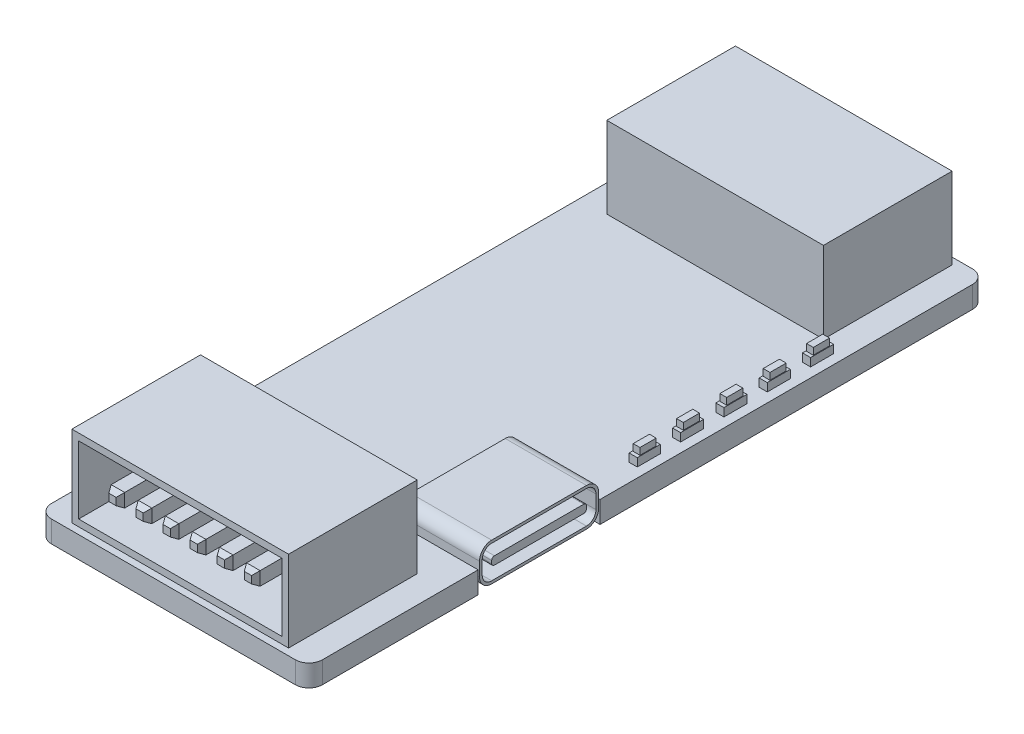
from build123d import *
from OCP.BRepFilletAPI import BRepFilletAPI_MakeChamfer

# Parameters (mm, degrees)
EXTRUDE_1_DEPTH        = 1.6
SKETCH_2_W             = 16
SKETCH_2_H             = 10
EXTRUDE_2_DEPTH        = 6
SKETCH_3_W             = 9
SKETCH_3_H             = 3
EXTRUDE_3_DEPTH        = 6
CUT_EXTRUDE_1_DEPTH    = 6
CUT_EXTRUDE_2_DEPTH    = 6
CUT_EXTRUDE_4_DEPTH    = 5
SKETCH_7_W             = 16
SKETCH_7_H             = 6
CUT_EXTRUDE_5_DEPTH    = 0.5
SKETCH_8_W             = 16
SKETCH_8_H             = 6
CUT_EXTRUDE_6_DEPTH    = 0.5
SKETCH_9_W             = 0.6
SKETCH_9_H             = 1.7
EXTRUDE_4_DEPTH        = 0.6
SKETCH_10_W            = 0.5
SKETCH_10_H            = 1.2
EXTRUDE_6_DEPTH        = 0.5
PATTERN_LINEAR_1_COUNT = 5
PATTERN_LINEAR_1_PITCH = 3.2
SKETCH_11_W            = 5.2
SKETCH_11_H            = 5.2
EXTRUDE_7_DEPTH        = 1.3
SKETCH_12_R            = 1
EXTRUDE_8_DEPTH        = 0.2
CHAMFER_1_SIZE         = 1
CUT_EXTRUDE_7_DEPTH    = 0.5
FILLET_1_R             = 0.5
FILLET_2_R             = 0.25
FILLET_3_R             = 0.1
SKETCH_14_W            = 15
SKETCH_14_H            = 5
SKETCH_14_W_2          = 1
SKETCH_14_H_2          = 1
CUT_EXTRUDE_8_DEPTH    = 8
CHAMFER_3_SIZE         = 0.4
CHAMFER_3_SIZE2        = 0.230940108
CHAMFER_4_SIZE         = 0.4
CHAMFER_4_SIZE2        = 0.230940108
CHAMFER_5_SIZE         = 0.4
CHAMFER_5_SIZE2        = 0.230940108


with BuildPart() as part:
    # 草图1 → 凸台-拉伸1 (new body)
    with BuildSketch(Plane(origin=(0, 0, 0), x_dir=(1, 0, 0), z_dir=(0, 1, 0))):
        with BuildLine():
            Line((-9, 25), (9, 25))
            ThreePointArc((9, 25), (9.707106781, 24.707106781), (10, 24))
            Line((10, 24), (10, -3.5))
            Line((10, -3.5), (4, -3.5))
            Line((4, -3.5), (4, -12.5))
            Line((4, -12.5), (10, -12.5))
            Line((10, -12.5), (10, -24))
            ThreePointArc((10, -24), (9.707106781, -24.707106781), (9, -25))
            Line((9, -25), (-9, -25))
            ThreePointArc((-9, -25), (-9.707106781, -24.707106781), (-10, -24))
            Line((-10, -24), (-10, 24))
            ThreePointArc((-10, 24), (-9.707106781, 24.707106781), (-9, 25))
        make_face()
    extrude(amount=EXTRUDE_1_DEPTH)

    # 草图2 → 凸台-拉伸2 (add)
    with BuildSketch(Plane(origin=(0, 1.6, 0), x_dir=(1, 0, 0), z_dir=(0, 1, 0))):
        with Locations((0, 20)):
            Rectangle(SKETCH_2_W, SKETCH_2_H)
        with Locations((0, -20)):
            Rectangle(SKETCH_2_W, SKETCH_2_H)
    extrude(amount=EXTRUDE_2_DEPTH)

    # 草图3 → 凸台-拉伸3 (add)
    with BuildSketch(Plane(origin=(4, 0, 0), x_dir=(0, 0, -1), z_dir=(1, 0, 0))):
        with Locations((-8, 1.6)):
            Rectangle(SKETCH_3_W, SKETCH_3_H)
    extrude(amount=EXTRUDE_3_DEPTH)

    # 草图4 → 切除-拉伸1 (cut)
    with BuildSketch(Plane(origin=(10, 0, 0), x_dir=(0, 0, -1), z_dir=(1, 0, 0))):
        with BuildLine():
            Line((-3.5, 1.1), (-3.5, 0.1))
            Line((-3.5, 0.1), (-4.5, 0.1))
            ThreePointArc((-4.5, 0.1), (-3.792893219, 0.392893219), (-3.5, 1.1))
        make_face()
        with BuildLine():
            Line((-12.5, 1.1), (-12.5, 0.1))
            Line((-12.5, 0.1), (-11.5, 0.1))
            ThreePointArc((-11.5, 0.1), (-12.207106781, 0.392893219), (-12.5, 1.1))
        make_face()
        with BuildLine():
            Line((-12.5, 3.1), (-12.5, 2.1))
            ThreePointArc((-12.5, 2.1), (-12.207106781, 2.807106781), (-11.5, 3.1))
            Line((-11.5, 3.1), (-12.5, 3.1))
        make_face()
        with BuildLine():
            Line((-3.5, 3.1), (-4.5, 3.1))
            ThreePointArc((-4.5, 3.1), (-3.792893219, 2.807106781), (-3.5, 2.1))
            Line((-3.5, 2.1), (-3.5, 3.1))
        make_face()
    extrude(amount=-CUT_EXTRUDE_1_DEPTH, mode=Mode.SUBTRACT)

    # 草图5 → 切除-拉伸2 (cut)
    with BuildSketch(Plane(origin=(10, 0, 0), x_dir=(0, 0, -1), z_dir=(1, 0, 0))):
        with BuildLine():
            Line((-11.5, 0.1), (-4.5, 0.1))
            ThreePointArc((-4.5, 0.1), (-3.792893219, 0.392893219), (-3.5, 1.1))
            Line((-3.5, 1.1), (-3.5, 2.1))
            ThreePointArc((-3.5, 2.1), (-3.792893219, 2.807106781), (-4.5, 3.1))
            Line((-4.5, 3.1), (-11.5, 3.1))
            ThreePointArc((-11.5, 3.1), (-12.207106781, 2.807106781), (-12.5, 2.1))
            Line((-12.5, 2.1), (-12.5, 1.1))
            ThreePointArc((-12.5, 1.1), (-12.207106781, 0.392893219), (-11.5, 0.1))
        make_face()
        with BuildLine():
            Line((-11.5, 0.2), (-4.5, 0.2))
            ThreePointArc((-4.5, 0.2), (-3.863603897, 0.463603897), (-3.6, 1.1))
            Line((-3.6, 1.1), (-3.6, 2.1))
            ThreePointArc((-3.6, 2.1), (-3.863603897, 2.736396103), (-4.5, 3))
            Line((-4.5, 3), (-11.5, 3))
            ThreePointArc((-11.5, 3), (-12.136396103, 2.736396103), (-12.4, 2.1))
            Line((-12.4, 2.1), (-12.4, 1.1))
            ThreePointArc((-12.4, 1.1), (-12.136396103, 0.463603897), (-11.5, 0.2))
        make_face(mode=Mode.SUBTRACT)
    extrude(amount=-CUT_EXTRUDE_2_DEPTH, mode=Mode.SUBTRACT)

    # 草图6 → 切除-拉伸4 (cut)
    with BuildSketch(Plane(origin=(10, 0, 0), x_dir=(0, 0, -1), z_dir=(1, 0, 0))):
        with BuildLine():
            Line((-11.5, 0.4), (-4.5, 0.4))
            ThreePointArc((-4.5, 0.4), (-4.005025253, 0.605025253), (-3.8, 1.1))
            Line((-3.8, 1.1), (-3.8, 2.1))
            ThreePointArc((-3.8, 2.1), (-4.005025253, 2.594974747), (-4.5, 2.8))
            Line((-4.5, 2.8), (-11.5, 2.8))
            ThreePointArc((-11.5, 2.8), (-11.994974747, 2.594974747), (-12.2, 2.1))
            Line((-12.2, 2.1), (-12.2, 1.1))
            ThreePointArc((-12.2, 1.1), (-11.994974747, 0.605025253), (-11.5, 0.4))
        make_face()
        with BuildLine():
            Line((-4.7, 1.9), (-11.3, 1.9))
            ThreePointArc((-11.3, 1.9), (-11.441421356, 1.841421356), (-11.5, 1.7))
            Line((-11.5, 1.7), (-11.5, 1.5))
            ThreePointArc((-11.5, 1.5), (-11.441421356, 1.358578644), (-11.3, 1.3))
            Line((-11.3, 1.3), (-4.7, 1.3))
            ThreePointArc((-4.7, 1.3), (-4.558578644, 1.358578644), (-4.5, 1.5))
            Line((-4.5, 1.5), (-4.5, 1.7))
            ThreePointArc((-4.5, 1.7), (-4.558578644, 1.841421356), (-4.7, 1.9))
        make_face(mode=Mode.SUBTRACT)
    extrude(amount=-CUT_EXTRUDE_4_DEPTH, mode=Mode.SUBTRACT)

    # 草图7 → 切除-拉伸5 (cut)
    with BuildSketch(Plane(origin=(0, 0, -25), x_dir=(-1, 0, 0), z_dir=(0, 0, -1))):
        with Locations((0, 4.6)):
            Rectangle(SKETCH_7_W, SKETCH_7_H)
    extrude(amount=-CUT_EXTRUDE_5_DEPTH, mode=Mode.SUBTRACT)

    # 草图8 → 切除-拉伸6 (cut)
    with BuildSketch(Plane.XY.offset(25)):
        with Locations((0, 4.6)):
            Rectangle(SKETCH_8_W, SKETCH_8_H)
    extrude(amount=-CUT_EXTRUDE_6_DEPTH, mode=Mode.SUBTRACT)

    # 草图9 → 凸台-拉伸4 (add)
    with BuildSketch(Plane(origin=(0, 1.6, 0), x_dir=(1, 0, 0), z_dir=(0, 1, 0))):
        with Locations((9, 13.6)):
            Rectangle(SKETCH_9_W, SKETCH_9_H)
    extrude_4 = extrude(amount=EXTRUDE_4_DEPTH)

    # 草图10 → 凸台-拉伸6 (add)
    with BuildSketch(Plane(origin=(0, 2.2, 0), x_dir=(1, 0, 0), z_dir=(0, 1, 0))):
        with Locations((9, 13.6)):
            Rectangle(SKETCH_10_W, SKETCH_10_H)
    extrude_6 = extrude(amount=EXTRUDE_6_DEPTH)

    # 阵列(线性)1: 凸台-拉伸4, 凸台-拉伸6 ×5
    with Locations(*[(0, 0, i * PATTERN_LINEAR_1_PITCH) for i in range(1, PATTERN_LINEAR_1_COUNT)]):
        add(extrude_4)
        add(extrude_6)

    # 草图11 → 凸台-拉伸7 (add)
    with BuildSketch(Plane(origin=(0, 0, 0), x_dir=(-1, 0, 0), z_dir=(0, -1, 0))):
        with Locations((0, 15)):
            Rectangle(SKETCH_11_W, SKETCH_11_H)
    extrude(amount=EXTRUDE_7_DEPTH)

    # 草图12 → 凸台-拉伸8 (add)
    with BuildSketch(Plane(origin=(0, -1.3, 0), x_dir=(-1, 0, 0), z_dir=(0, -1, 0))):
        with Locations(Location((0, 15, 0), (0, 0, 90))):
            Circle(SKETCH_12_R)
    extrude(amount=EXTRUDE_8_DEPTH)

    # 倒角1
    chamfer_1_edges = [part.edges().sort_by_distance(p)[0] for p in [
        (-2.6, -0.65, -12.4),
        (-2.6, -0.65, -17.6),
        (2.6, -0.65, -17.6),
        (2.6, -0.65, -12.4),
    ]]
    chamfer(chamfer_1_edges, length=CHAMFER_1_SIZE)

    # 草图13 → 切除-拉伸7 (cut)
    with BuildSketch(Plane(origin=(0, -1.3, 0), x_dir=(-1, 0, 0), z_dir=(0, -1, 0))):
        Polygon((1.6, 17.6), (-1.6, 17.6), (-2.6, 16.6), (-2.6, 13.4), (-1.6, 12.4), (1.6, 12.4), (2.6, 13.4), (2.6, 16.6), align=None)
        Polygon((1.185786438, 16.6), (-1.185786438, 16.6), (-1.6, 16.185786438), (-1.6, 13.814213562), (-1.185786438, 13.4), (1.185786438, 13.4), (1.6, 13.814213562), (1.6, 16.185786438), align=None, mode=Mode.SUBTRACT)
    extrude(amount=-CUT_EXTRUDE_7_DEPTH, mode=Mode.SUBTRACT)

    # 圆角1
    fillet_1_edges = [part.edges().sort_by_distance(p)[0] for p in [
        (2.6, -0.4, -13.4),
        (1.6, -0.4, -17.6),
        (-2.6, -0.4, -16.6),
        (-1.6, -0.4, -12.4),
        (1.6, -0.4, -12.4),
        (-2.6, -0.4, -13.4),
        (-1.6, -0.4, -17.6),
        (2.6, -0.4, -16.6),
        (-1.6, -1.05, -16.185786438),
        (-1.6, -1.05, -13.814213562),
        (-1.185786438, -1.05, -13.4),
        (1.185786438, -1.05, -13.4),
        (1.6, -1.05, -13.814213562),
        (1.6, -1.05, -16.185786438),
        (1.185786438, -1.05, -16.6),
        (-1.185786438, -1.05, -16.6),
    ]]
    fillet(fillet_1_edges, radius=FILLET_1_R)

    # 圆角2
    fillet_2_edges = [part.edges().sort_by_distance(p)[0] for p in [
        (2.561939766, -0.8, -16.584234935),
        (2.1, -0.8, -17.1),
        (1.584234935, -0.8, -17.561939766),
        (0, -0.8, -17.6),
        (-1.584234935, -0.8, -17.561939766),
        (-2.1, -0.8, -17.1),
        (-2.561939766, -0.8, -16.584234935),
        (-2.6, -0.8, -15),
        (-2.561939766, -0.8, -13.415765065),
        (-2.1, -0.8, -12.9),
        (-1.584234935, -0.8, -12.438060234),
        (0, -0.8, -12.4),
        (1.584234935, -0.8, -12.438060234),
        (2.1, -0.8, -12.9),
        (2.561939766, -0.8, -13.415765065),
        (1.561939766, -1.3, -16.170021373),
        (1.392893219, -1.3, -16.392893219),
        (1.170021373, -1.3, -16.561939766),
        (0, -1.3, -16.6),
        (-1.170021373, -1.3, -16.561939766),
        (-1.392893219, -1.3, -16.392893219),
        (-1.561939766, -1.3, -16.170021373),
        (-1.6, -1.3, -15),
        (-1.561939766, -1.3, -13.829978627),
        (-1.392893219, -1.3, -13.607106781),
        (-1.170021373, -1.3, -13.438060234),
        (0, -1.3, -13.4),
        (1.170021373, -1.3, -13.438060234),
        (1.392893219, -1.3, -13.607106781),
        (1.561939766, -1.3, -13.829978627),
        (1.561939766, -0.8, -16.170021373),
        (1.392893219, -0.8, -16.392893219),
        (1.170021373, -0.8, -16.561939766),
        (0, -0.8, -16.6),
        (-1.170021373, -0.8, -16.561939766),
        (-1.392893219, -0.8, -16.392893219),
        (-1.561939766, -0.8, -16.170021373),
        (-1.6, -0.8, -15),
        (-1.561939766, -0.8, -13.829978627),
        (-1.392893219, -0.8, -13.607106781),
        (-1.170021373, -0.8, -13.438060234),
        (0, -0.8, -13.4),
        (1.170021373, -0.8, -13.438060234),
        (1.392893219, -0.8, -13.607106781),
        (1.561939766, -0.8, -13.829978627),
        (2.6, -0.8, -15),
        (1.6, -1.3, -15),
        (1.6, -0.8, -15),
    ]]
    fillet(fillet_2_edges, radius=FILLET_2_R - 0.0001)  # a hair under: the kernel refuses the full size

    # 圆角3
    fillet_3_edges = [part.edges().sort_by_distance(p)[0] for p in [
        (0, -1.5, -14),
    ]]
    fillet(fillet_3_edges, radius=FILLET_3_R)

    # 草图14 → 切除-拉伸8 (cut)
    with BuildSketch(Plane(origin=(0, 0, -24.5), x_dir=(-1, 0, 0), z_dir=(0, 0, -1))):
        with Locations((0, 4.6)):
            Rectangle(SKETCH_14_W, SKETCH_14_H)
        with Locations((-5, 4.6)):
            Rectangle(SKETCH_14_W_2, SKETCH_14_H_2, mode=Mode.SUBTRACT)
        with Locations((-3, 4.6)):
            Rectangle(SKETCH_14_W_2, SKETCH_14_H_2, mode=Mode.SUBTRACT)
        with Locations((-1, 4.6)):
            Rectangle(SKETCH_14_W_2, SKETCH_14_H_2, mode=Mode.SUBTRACT)
        with Locations((1, 4.6)):
            Rectangle(SKETCH_14_W_2, SKETCH_14_H_2, mode=Mode.SUBTRACT)
        with Locations((3, 4.6)):
            Rectangle(SKETCH_14_W_2, SKETCH_14_H_2, mode=Mode.SUBTRACT)
        with Locations((5, 4.6)):
            Rectangle(SKETCH_14_W_2, SKETCH_14_H_2, mode=Mode.SUBTRACT)
    cut_extrude_8 = extrude(amount=-CUT_EXTRUDE_8_DEPTH, mode=Mode.SUBTRACT)

    # 倒角3: one chamfer whose edges measure the first distance from different faces: ONE call of the kernel's chamfer builder (chamfer() names one face for all edges)
    chamfer_3_edges_1 = [part.edges().sort_by_distance(p)[0] for p in [
        (-4.5, 4.6, -24.5),
    ]]
    chamfer_3_side_1 = [part.faces().sort_by_distance(p)[0] for p in [
        (-4.5, 4.6, -20.5),
    ]]
    chamfer_3_edges_2 = [part.edges().sort_by_distance(p)[0] for p in [
        (-5, 4.1, -24.5),
    ]]
    chamfer_3_side_2 = [part.faces().sort_by_distance(p)[0] for p in [
        (-5, 4.1, -20.5),
    ]]
    chamfer_3_edges_3 = [part.edges().sort_by_distance(p)[0] for p in [
        (-5, 5.1, -24.5),
    ]]
    chamfer_3_side_3 = [part.faces().sort_by_distance(p)[0] for p in [
        (-5, 5.1, -20.5),
    ]]
    chamfer_3_edges_4 = [part.edges().sort_by_distance(p)[0] for p in [
        (-5.5, 4.6, -24.5),
    ]]
    chamfer_3_side_4 = [part.faces().sort_by_distance(p)[0] for p in [
        (-5.5, 4.6, -20.5),
    ]]
    chamfer_3 = BRepFilletAPI_MakeChamfer(part.part.solid().wrapped)
    for e in chamfer_3_edges_1:
        chamfer_3.Add(CHAMFER_3_SIZE, CHAMFER_3_SIZE2, e.wrapped, chamfer_3_side_1[0].wrapped)  # the first distance lies on this face
    for e in chamfer_3_edges_2:
        chamfer_3.Add(CHAMFER_3_SIZE, CHAMFER_3_SIZE2, e.wrapped, chamfer_3_side_2[0].wrapped)  # the first distance lies on this face
    for e in chamfer_3_edges_3:
        chamfer_3.Add(CHAMFER_3_SIZE, CHAMFER_3_SIZE2, e.wrapped, chamfer_3_side_3[0].wrapped)  # the first distance lies on this face
    for e in chamfer_3_edges_4:
        chamfer_3.Add(CHAMFER_3_SIZE, CHAMFER_3_SIZE2, e.wrapped, chamfer_3_side_4[0].wrapped)  # the first distance lies on this face
    add(Compound.cast(chamfer_3.Shape()), mode=Mode.REPLACE)

    # 倒角4: one chamfer whose edges measure the first distance from different faces: ONE call of the kernel's chamfer builder (chamfer() names one face for all edges)
    chamfer_4_edges_1 = [part.edges().sort_by_distance(p)[0] for p in [
        (-3, 4.1, -24.5),
    ]]
    chamfer_4_side_1 = [part.faces().sort_by_distance(p)[0] for p in [
        (-3, 4.1, -20.5),
    ]]
    chamfer_4_edges_2 = [part.edges().sort_by_distance(p)[0] for p in [
        (-1, 4.1, -24.5),
    ]]
    chamfer_4_side_2 = [part.faces().sort_by_distance(p)[0] for p in [
        (-1, 4.1, -20.5),
    ]]
    chamfer_4_edges_3 = [part.edges().sort_by_distance(p)[0] for p in [
        (1, 4.1, -24.5),
    ]]
    chamfer_4_side_3 = [part.faces().sort_by_distance(p)[0] for p in [
        (1, 4.1, -20.5),
    ]]
    chamfer_4_edges_4 = [part.edges().sort_by_distance(p)[0] for p in [
        (3, 4.1, -24.5),
    ]]
    chamfer_4_side_4 = [part.faces().sort_by_distance(p)[0] for p in [
        (3, 4.1, -20.5),
    ]]
    chamfer_4_edges_5 = [part.edges().sort_by_distance(p)[0] for p in [
        (5, 4.1, -24.5),
    ]]
    chamfer_4_side_5 = [part.faces().sort_by_distance(p)[0] for p in [
        (5, 4.1, -20.5),
    ]]
    chamfer_4_edges_6 = [part.edges().sort_by_distance(p)[0] for p in [
        (-2.5, 4.6, -24.5),
    ]]
    chamfer_4_side_6 = [part.faces().sort_by_distance(p)[0] for p in [
        (-2.5, 4.6, -20.5),
    ]]
    chamfer_4_edges_7 = [part.edges().sort_by_distance(p)[0] for p in [
        (-0.5, 4.6, -24.5),
    ]]
    chamfer_4_side_7 = [part.faces().sort_by_distance(p)[0] for p in [
        (-0.5, 4.6, -20.5),
    ]]
    chamfer_4_edges_8 = [part.edges().sort_by_distance(p)[0] for p in [
        (1.5, 4.6, -24.5),
    ]]
    chamfer_4_side_8 = [part.faces().sort_by_distance(p)[0] for p in [
        (1.5, 4.6, -20.5),
    ]]
    chamfer_4_edges_9 = [part.edges().sort_by_distance(p)[0] for p in [
        (3.5, 4.6, -24.5),
    ]]
    chamfer_4_side_9 = [part.faces().sort_by_distance(p)[0] for p in [
        (3.5, 4.6, -20.5),
    ]]
    chamfer_4_edges_10 = [part.edges().sort_by_distance(p)[0] for p in [
        (5.5, 4.6, -24.5),
    ]]
    chamfer_4_side_10 = [part.faces().sort_by_distance(p)[0] for p in [
        (5.5, 4.6, -20.5),
    ]]
    chamfer_4_edges_11 = [part.edges().sort_by_distance(p)[0] for p in [
        (5, 5.1, -24.5),
    ]]
    chamfer_4_side_11 = [part.faces().sort_by_distance(p)[0] for p in [
        (5, 5.1, -20.5),
    ]]
    chamfer_4_edges_12 = [part.edges().sort_by_distance(p)[0] for p in [
        (4.5, 4.6, -24.5),
    ]]
    chamfer_4_side_12 = [part.faces().sort_by_distance(p)[0] for p in [
        (4.5, 4.6, -20.5),
    ]]
    chamfer_4_edges_13 = [part.edges().sort_by_distance(p)[0] for p in [
        (3, 5.1, -24.5),
    ]]
    chamfer_4_side_13 = [part.faces().sort_by_distance(p)[0] for p in [
        (3, 5.1, -20.5),
    ]]
    chamfer_4_edges_14 = [part.edges().sort_by_distance(p)[0] for p in [
        (2.5, 4.6, -24.5),
    ]]
    chamfer_4_side_14 = [part.faces().sort_by_distance(p)[0] for p in [
        (2.5, 4.6, -20.5),
    ]]
    chamfer_4_edges_15 = [part.edges().sort_by_distance(p)[0] for p in [
        (1, 5.1, -24.5),
    ]]
    chamfer_4_side_15 = [part.faces().sort_by_distance(p)[0] for p in [
        (1, 5.1, -20.5),
    ]]
    chamfer_4_edges_16 = [part.edges().sort_by_distance(p)[0] for p in [
        (0.5, 4.6, -24.5),
    ]]
    chamfer_4_side_16 = [part.faces().sort_by_distance(p)[0] for p in [
        (0.5, 4.6, -20.5),
    ]]
    chamfer_4_edges_17 = [part.edges().sort_by_distance(p)[0] for p in [
        (-1, 5.1, -24.5),
    ]]
    chamfer_4_side_17 = [part.faces().sort_by_distance(p)[0] for p in [
        (-1, 5.1, -20.5),
    ]]
    chamfer_4_edges_18 = [part.edges().sort_by_distance(p)[0] for p in [
        (-1.5, 4.6, -24.5),
    ]]
    chamfer_4_side_18 = [part.faces().sort_by_distance(p)[0] for p in [
        (-1.5, 4.6, -20.5),
    ]]
    chamfer_4_edges_19 = [part.edges().sort_by_distance(p)[0] for p in [
        (-3, 5.1, -24.5),
    ]]
    chamfer_4_side_19 = [part.faces().sort_by_distance(p)[0] for p in [
        (-3, 5.1, -20.5),
    ]]
    chamfer_4_edges_20 = [part.edges().sort_by_distance(p)[0] for p in [
        (-3.5, 4.6, -24.5),
    ]]
    chamfer_4_side_20 = [part.faces().sort_by_distance(p)[0] for p in [
        (-3.5, 4.6, -20.5),
    ]]
    chamfer_4 = BRepFilletAPI_MakeChamfer(part.part.solid().wrapped)
    for e in chamfer_4_edges_1:
        chamfer_4.Add(CHAMFER_4_SIZE, CHAMFER_4_SIZE2, e.wrapped, chamfer_4_side_1[0].wrapped)  # the first distance lies on this face
    for e in chamfer_4_edges_2:
        chamfer_4.Add(CHAMFER_4_SIZE, CHAMFER_4_SIZE2, e.wrapped, chamfer_4_side_2[0].wrapped)  # the first distance lies on this face
    for e in chamfer_4_edges_3:
        chamfer_4.Add(CHAMFER_4_SIZE, CHAMFER_4_SIZE2, e.wrapped, chamfer_4_side_3[0].wrapped)  # the first distance lies on this face
    for e in chamfer_4_edges_4:
        chamfer_4.Add(CHAMFER_4_SIZE, CHAMFER_4_SIZE2, e.wrapped, chamfer_4_side_4[0].wrapped)  # the first distance lies on this face
    for e in chamfer_4_edges_5:
        chamfer_4.Add(CHAMFER_4_SIZE, CHAMFER_4_SIZE2, e.wrapped, chamfer_4_side_5[0].wrapped)  # the first distance lies on this face
    for e in chamfer_4_edges_6:
        chamfer_4.Add(CHAMFER_4_SIZE, CHAMFER_4_SIZE2, e.wrapped, chamfer_4_side_6[0].wrapped)  # the first distance lies on this face
    for e in chamfer_4_edges_7:
        chamfer_4.Add(CHAMFER_4_SIZE, CHAMFER_4_SIZE2, e.wrapped, chamfer_4_side_7[0].wrapped)  # the first distance lies on this face
    for e in chamfer_4_edges_8:
        chamfer_4.Add(CHAMFER_4_SIZE, CHAMFER_4_SIZE2, e.wrapped, chamfer_4_side_8[0].wrapped)  # the first distance lies on this face
    for e in chamfer_4_edges_9:
        chamfer_4.Add(CHAMFER_4_SIZE, CHAMFER_4_SIZE2, e.wrapped, chamfer_4_side_9[0].wrapped)  # the first distance lies on this face
    for e in chamfer_4_edges_10:
        chamfer_4.Add(CHAMFER_4_SIZE, CHAMFER_4_SIZE2, e.wrapped, chamfer_4_side_10[0].wrapped)  # the first distance lies on this face
    for e in chamfer_4_edges_11:
        chamfer_4.Add(CHAMFER_4_SIZE, CHAMFER_4_SIZE2, e.wrapped, chamfer_4_side_11[0].wrapped)  # the first distance lies on this face
    for e in chamfer_4_edges_12:
        chamfer_4.Add(CHAMFER_4_SIZE, CHAMFER_4_SIZE2, e.wrapped, chamfer_4_side_12[0].wrapped)  # the first distance lies on this face
    for e in chamfer_4_edges_13:
        chamfer_4.Add(CHAMFER_4_SIZE, CHAMFER_4_SIZE2, e.wrapped, chamfer_4_side_13[0].wrapped)  # the first distance lies on this face
    for e in chamfer_4_edges_14:
        chamfer_4.Add(CHAMFER_4_SIZE, CHAMFER_4_SIZE2, e.wrapped, chamfer_4_side_14[0].wrapped)  # the first distance lies on this face
    for e in chamfer_4_edges_15:
        chamfer_4.Add(CHAMFER_4_SIZE, CHAMFER_4_SIZE2, e.wrapped, chamfer_4_side_15[0].wrapped)  # the first distance lies on this face
    for e in chamfer_4_edges_16:
        chamfer_4.Add(CHAMFER_4_SIZE, CHAMFER_4_SIZE2, e.wrapped, chamfer_4_side_16[0].wrapped)  # the first distance lies on this face
    for e in chamfer_4_edges_17:
        chamfer_4.Add(CHAMFER_4_SIZE, CHAMFER_4_SIZE2, e.wrapped, chamfer_4_side_17[0].wrapped)  # the first distance lies on this face
    for e in chamfer_4_edges_18:
        chamfer_4.Add(CHAMFER_4_SIZE, CHAMFER_4_SIZE2, e.wrapped, chamfer_4_side_18[0].wrapped)  # the first distance lies on this face
    for e in chamfer_4_edges_19:
        chamfer_4.Add(CHAMFER_4_SIZE, CHAMFER_4_SIZE2, e.wrapped, chamfer_4_side_19[0].wrapped)  # the first distance lies on this face
    for e in chamfer_4_edges_20:
        chamfer_4.Add(CHAMFER_4_SIZE, CHAMFER_4_SIZE2, e.wrapped, chamfer_4_side_20[0].wrapped)  # the first distance lies on this face
    add(Compound.cast(chamfer_4.Shape()), mode=Mode.REPLACE)

    # 镜向3: 切除-拉伸8 across plane
    add(cut_extrude_8.mirror(Plane.XY), mode=Mode.SUBTRACT)

    # 倒角5: one chamfer whose edges measure the first distance from different faces: ONE call of the kernel's chamfer builder (chamfer() names one face for all edges)
    chamfer_5_edges_1 = [part.edges().sort_by_distance(p)[0] for p in [
        (-5, 5.1, 24.5),
    ]]
    chamfer_5_side_1 = [part.faces().sort_by_distance(p)[0] for p in [
        (-5, 5.1, 20.5),
    ]]
    chamfer_5_edges_2 = [part.edges().sort_by_distance(p)[0] for p in [
        (-5.5, 4.6, 24.5),
    ]]
    chamfer_5_side_2 = [part.faces().sort_by_distance(p)[0] for p in [
        (-5.5, 4.6, 20.5),
    ]]
    chamfer_5_edges_3 = [part.edges().sort_by_distance(p)[0] for p in [
        (-3, 5.1, 24.5),
    ]]
    chamfer_5_side_3 = [part.faces().sort_by_distance(p)[0] for p in [
        (-3, 5.1, 20.5),
    ]]
    chamfer_5_edges_4 = [part.edges().sort_by_distance(p)[0] for p in [
        (-1, 5.1, 24.5),
    ]]
    chamfer_5_side_4 = [part.faces().sort_by_distance(p)[0] for p in [
        (-1, 5.1, 20.5),
    ]]
    chamfer_5_edges_5 = [part.edges().sort_by_distance(p)[0] for p in [
        (1, 5.1, 24.5),
    ]]
    chamfer_5_side_5 = [part.faces().sort_by_distance(p)[0] for p in [
        (1, 5.1, 20.5),
    ]]
    chamfer_5_edges_6 = [part.edges().sort_by_distance(p)[0] for p in [
        (3, 5.1, 24.5),
    ]]
    chamfer_5_side_6 = [part.faces().sort_by_distance(p)[0] for p in [
        (3, 5.1, 20.5),
    ]]
    chamfer_5_edges_7 = [part.edges().sort_by_distance(p)[0] for p in [
        (5, 5.1, 24.5),
    ]]
    chamfer_5_side_7 = [part.faces().sort_by_distance(p)[0] for p in [
        (5, 5.1, 20.5),
    ]]
    chamfer_5_edges_8 = [part.edges().sort_by_distance(p)[0] for p in [
        (-3.5, 4.6, 24.5),
    ]]
    chamfer_5_side_8 = [part.faces().sort_by_distance(p)[0] for p in [
        (-3.5, 4.6, 20.5),
    ]]
    chamfer_5_edges_9 = [part.edges().sort_by_distance(p)[0] for p in [
        (-1.5, 4.6, 24.5),
    ]]
    chamfer_5_side_9 = [part.faces().sort_by_distance(p)[0] for p in [
        (-1.5, 4.6, 20.5),
    ]]
    chamfer_5_edges_10 = [part.edges().sort_by_distance(p)[0] for p in [
        (0.5, 4.6, 24.5),
    ]]
    chamfer_5_side_10 = [part.faces().sort_by_distance(p)[0] for p in [
        (0.5, 4.6, 20.5),
    ]]
    chamfer_5_edges_11 = [part.edges().sort_by_distance(p)[0] for p in [
        (2.5, 4.6, 24.5),
    ]]
    chamfer_5_side_11 = [part.faces().sort_by_distance(p)[0] for p in [
        (2.5, 4.6, 20.5),
    ]]
    chamfer_5_edges_12 = [part.edges().sort_by_distance(p)[0] for p in [
        (4.5, 4.6, 24.5),
    ]]
    chamfer_5_side_12 = [part.faces().sort_by_distance(p)[0] for p in [
        (4.5, 4.6, 20.5),
    ]]
    chamfer_5_edges_13 = [part.edges().sort_by_distance(p)[0] for p in [
        (5, 4.1, 24.5),
    ]]
    chamfer_5_side_13 = [part.faces().sort_by_distance(p)[0] for p in [
        (5, 4.1, 20.5),
    ]]
    chamfer_5_edges_14 = [part.edges().sort_by_distance(p)[0] for p in [
        (5.5, 4.6, 24.5),
    ]]
    chamfer_5_side_14 = [part.faces().sort_by_distance(p)[0] for p in [
        (5.5, 4.6, 20.5),
    ]]
    chamfer_5_edges_15 = [part.edges().sort_by_distance(p)[0] for p in [
        (3, 4.1, 24.5),
    ]]
    chamfer_5_side_15 = [part.faces().sort_by_distance(p)[0] for p in [
        (3, 4.1, 20.5),
    ]]
    chamfer_5_edges_16 = [part.edges().sort_by_distance(p)[0] for p in [
        (3.5, 4.6, 24.5),
    ]]
    chamfer_5_side_16 = [part.faces().sort_by_distance(p)[0] for p in [
        (3.5, 4.6, 20.5),
    ]]
    chamfer_5_edges_17 = [part.edges().sort_by_distance(p)[0] for p in [
        (1, 4.1, 24.5),
    ]]
    chamfer_5_side_17 = [part.faces().sort_by_distance(p)[0] for p in [
        (1, 4.1, 20.5),
    ]]
    chamfer_5_edges_18 = [part.edges().sort_by_distance(p)[0] for p in [
        (1.5, 4.6, 24.5),
    ]]
    chamfer_5_side_18 = [part.faces().sort_by_distance(p)[0] for p in [
        (1.5, 4.6, 20.5),
    ]]
    chamfer_5_edges_19 = [part.edges().sort_by_distance(p)[0] for p in [
        (-1, 4.1, 24.5),
    ]]
    chamfer_5_side_19 = [part.faces().sort_by_distance(p)[0] for p in [
        (-1, 4.1, 20.5),
    ]]
    chamfer_5_edges_20 = [part.edges().sort_by_distance(p)[0] for p in [
        (-0.5, 4.6, 24.5),
    ]]
    chamfer_5_side_20 = [part.faces().sort_by_distance(p)[0] for p in [
        (-0.5, 4.6, 20.5),
    ]]
    chamfer_5_edges_21 = [part.edges().sort_by_distance(p)[0] for p in [
        (-3, 4.1, 24.5),
    ]]
    chamfer_5_side_21 = [part.faces().sort_by_distance(p)[0] for p in [
        (-3, 4.1, 20.5),
    ]]
    chamfer_5_edges_22 = [part.edges().sort_by_distance(p)[0] for p in [
        (-2.5, 4.6, 24.5),
    ]]
    chamfer_5_side_22 = [part.faces().sort_by_distance(p)[0] for p in [
        (-2.5, 4.6, 20.5),
    ]]
    chamfer_5_edges_23 = [part.edges().sort_by_distance(p)[0] for p in [
        (-4.5, 4.6, 24.5),
    ]]
    chamfer_5_side_23 = [part.faces().sort_by_distance(p)[0] for p in [
        (-4.5, 4.6, 20.5),
    ]]
    chamfer_5_edges_24 = [part.edges().sort_by_distance(p)[0] for p in [
        (-5, 4.1, 24.5),
    ]]
    chamfer_5_side_24 = [part.faces().sort_by_distance(p)[0] for p in [
        (-5, 4.1, 20.5),
    ]]
    chamfer_5 = BRepFilletAPI_MakeChamfer(part.part.solid().wrapped)
    for e in chamfer_5_edges_1:
        chamfer_5.Add(CHAMFER_5_SIZE, CHAMFER_5_SIZE2, e.wrapped, chamfer_5_side_1[0].wrapped)  # the first distance lies on this face
    for e in chamfer_5_edges_2:
        chamfer_5.Add(CHAMFER_5_SIZE, CHAMFER_5_SIZE2, e.wrapped, chamfer_5_side_2[0].wrapped)  # the first distance lies on this face
    for e in chamfer_5_edges_3:
        chamfer_5.Add(CHAMFER_5_SIZE, CHAMFER_5_SIZE2, e.wrapped, chamfer_5_side_3[0].wrapped)  # the first distance lies on this face
    for e in chamfer_5_edges_4:
        chamfer_5.Add(CHAMFER_5_SIZE, CHAMFER_5_SIZE2, e.wrapped, chamfer_5_side_4[0].wrapped)  # the first distance lies on this face
    for e in chamfer_5_edges_5:
        chamfer_5.Add(CHAMFER_5_SIZE, CHAMFER_5_SIZE2, e.wrapped, chamfer_5_side_5[0].wrapped)  # the first distance lies on this face
    for e in chamfer_5_edges_6:
        chamfer_5.Add(CHAMFER_5_SIZE, CHAMFER_5_SIZE2, e.wrapped, chamfer_5_side_6[0].wrapped)  # the first distance lies on this face
    for e in chamfer_5_edges_7:
        chamfer_5.Add(CHAMFER_5_SIZE, CHAMFER_5_SIZE2, e.wrapped, chamfer_5_side_7[0].wrapped)  # the first distance lies on this face
    for e in chamfer_5_edges_8:
        chamfer_5.Add(CHAMFER_5_SIZE, CHAMFER_5_SIZE2, e.wrapped, chamfer_5_side_8[0].wrapped)  # the first distance lies on this face
    for e in chamfer_5_edges_9:
        chamfer_5.Add(CHAMFER_5_SIZE, CHAMFER_5_SIZE2, e.wrapped, chamfer_5_side_9[0].wrapped)  # the first distance lies on this face
    for e in chamfer_5_edges_10:
        chamfer_5.Add(CHAMFER_5_SIZE, CHAMFER_5_SIZE2, e.wrapped, chamfer_5_side_10[0].wrapped)  # the first distance lies on this face
    for e in chamfer_5_edges_11:
        chamfer_5.Add(CHAMFER_5_SIZE, CHAMFER_5_SIZE2, e.wrapped, chamfer_5_side_11[0].wrapped)  # the first distance lies on this face
    for e in chamfer_5_edges_12:
        chamfer_5.Add(CHAMFER_5_SIZE, CHAMFER_5_SIZE2, e.wrapped, chamfer_5_side_12[0].wrapped)  # the first distance lies on this face
    for e in chamfer_5_edges_13:
        chamfer_5.Add(CHAMFER_5_SIZE, CHAMFER_5_SIZE2, e.wrapped, chamfer_5_side_13[0].wrapped)  # the first distance lies on this face
    for e in chamfer_5_edges_14:
        chamfer_5.Add(CHAMFER_5_SIZE, CHAMFER_5_SIZE2, e.wrapped, chamfer_5_side_14[0].wrapped)  # the first distance lies on this face
    for e in chamfer_5_edges_15:
        chamfer_5.Add(CHAMFER_5_SIZE, CHAMFER_5_SIZE2, e.wrapped, chamfer_5_side_15[0].wrapped)  # the first distance lies on this face
    for e in chamfer_5_edges_16:
        chamfer_5.Add(CHAMFER_5_SIZE, CHAMFER_5_SIZE2, e.wrapped, chamfer_5_side_16[0].wrapped)  # the first distance lies on this face
    for e in chamfer_5_edges_17:
        chamfer_5.Add(CHAMFER_5_SIZE, CHAMFER_5_SIZE2, e.wrapped, chamfer_5_side_17[0].wrapped)  # the first distance lies on this face
    for e in chamfer_5_edges_18:
        chamfer_5.Add(CHAMFER_5_SIZE, CHAMFER_5_SIZE2, e.wrapped, chamfer_5_side_18[0].wrapped)  # the first distance lies on this face
    for e in chamfer_5_edges_19:
        chamfer_5.Add(CHAMFER_5_SIZE, CHAMFER_5_SIZE2, e.wrapped, chamfer_5_side_19[0].wrapped)  # the first distance lies on this face
    for e in chamfer_5_edges_20:
        chamfer_5.Add(CHAMFER_5_SIZE, CHAMFER_5_SIZE2, e.wrapped, chamfer_5_side_20[0].wrapped)  # the first distance lies on this face
    for e in chamfer_5_edges_21:
        chamfer_5.Add(CHAMFER_5_SIZE, CHAMFER_5_SIZE2, e.wrapped, chamfer_5_side_21[0].wrapped)  # the first distance lies on this face
    for e in chamfer_5_edges_22:
        chamfer_5.Add(CHAMFER_5_SIZE, CHAMFER_5_SIZE2, e.wrapped, chamfer_5_side_22[0].wrapped)  # the first distance lies on this face
    for e in chamfer_5_edges_23:
        chamfer_5.Add(CHAMFER_5_SIZE, CHAMFER_5_SIZE2, e.wrapped, chamfer_5_side_23[0].wrapped)  # the first distance lies on this face
    for e in chamfer_5_edges_24:
        chamfer_5.Add(CHAMFER_5_SIZE, CHAMFER_5_SIZE2, e.wrapped, chamfer_5_side_24[0].wrapped)  # the first distance lies on this face
    add(Compound.cast(chamfer_5.Shape()), mode=Mode.REPLACE)


solid = part.part
